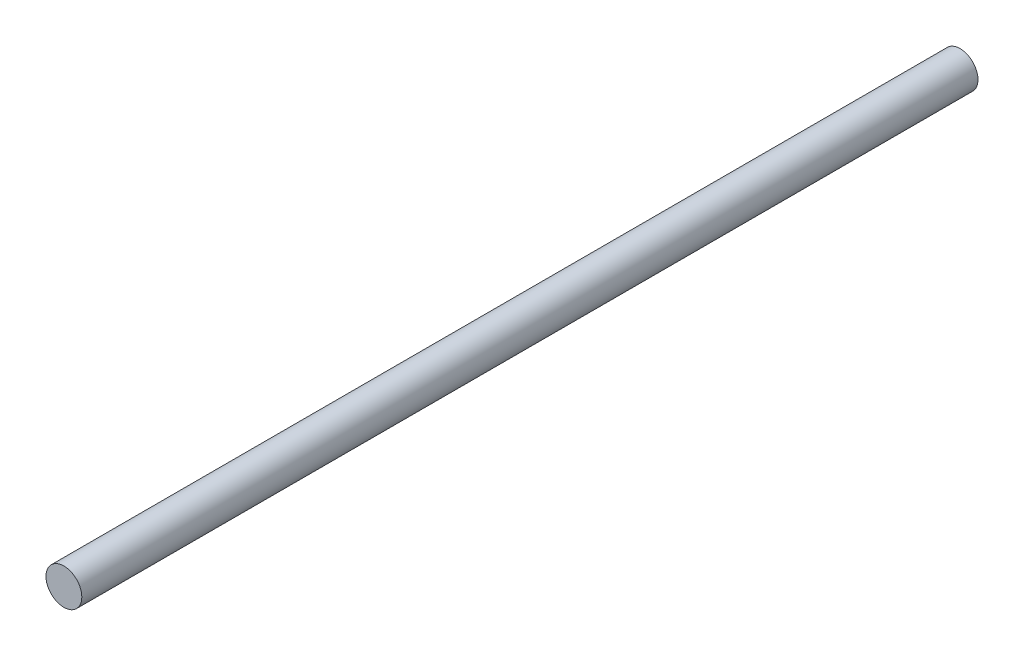
from build123d import *

# Parameters (mm, degrees)
SKETCH1_R           = 5.08
BOSS_EXTRUDE1_DEPTH = 254


with BuildPart() as part:
    # Sketch1 → Boss-Extrude1 (new body)
    with BuildSketch(Plane.XY):
        Circle(SKETCH1_R)
    extrude(amount=BOSS_EXTRUDE1_DEPTH)


solid = part.part
